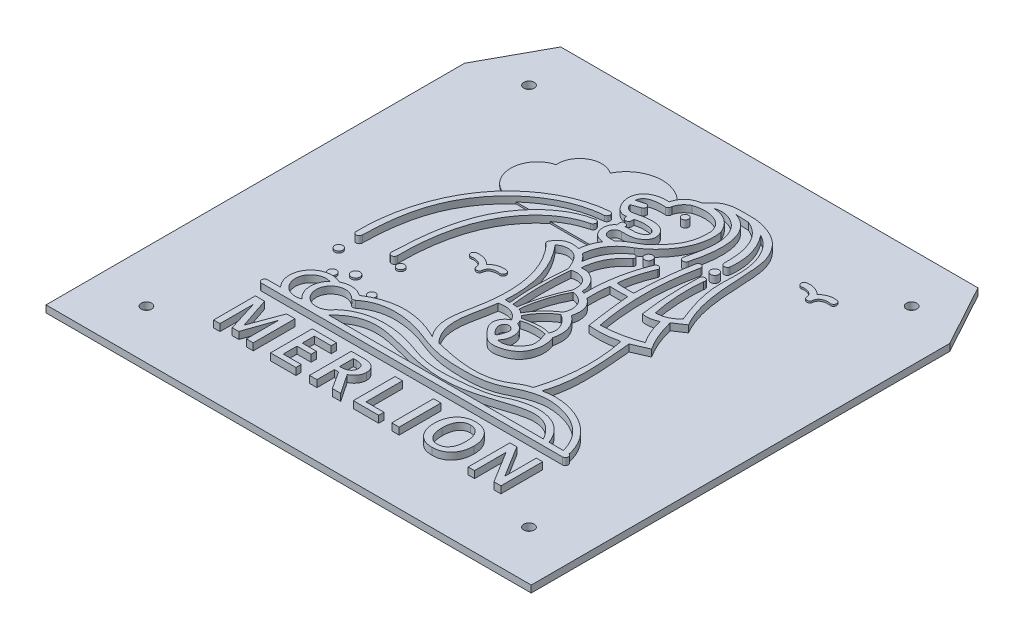
from build123d import *

# Parameters (mm, degrees)
SKETCH2_R           = 1.5
BOSS_EXTRUDE1_DEPTH = 2
SKETCH7_R           = 0.983682585
SKETCH7_R_2         = 1.165243801
SKETCH7_R_3         = 1.175134234
BOSS_EXTRUDE7_DEPTH = 2
SKETCH8_R           = 1.105287723
SKETCH8_R_2         = 1.166518973
SKETCH8_R_3         = 1.187770486
SKETCH8_R_4         = 1.27175729
SKETCH8_R_5         = 1.10281721
BOSS_EXTRUDE8_DEPTH = 0.5
SKETCH9_W           = 2.126582278
SKETCH9_H           = 12
BOSS_EXTRUDE9_DEPTH = 2


with BuildPart() as part:
    # Sketch2 → Boss-Extrude1 (new body)
    with BuildSketch(Plane(origin=(0, 0, 0), x_dir=(1, 0, 0), z_dir=(0, 1, 0))):
        Polygon((-69.75, 120.33), (-69.75, 0), (69.75, 0), (69.75, 120.33), (59.98, 138.212299614), (-59.98, 138.212299614), align=None)
        with Locations(Location((-55, 124.11, 0), (0, 0, 270))):
            Circle(SKETCH2_R, mode=Mode.SUBTRACT)
        with Locations(Location((55, 124.11, 0), (0, 0, 270))):
            Circle(SKETCH2_R, mode=Mode.SUBTRACT)
        with Locations(Location((55, 14.11, 0), (0, 0, 270))):
            Circle(SKETCH2_R, mode=Mode.SUBTRACT)
        with Locations(Location((-55, 14.11, 0), (0, 0, 270))):
            Circle(SKETCH2_R, mode=Mode.SUBTRACT)
    extrude(amount=BOSS_EXTRUDE1_DEPTH)

    # Sketch7 → Boss-Extrude7 (add)
    # profile 1 of 6: a face of its own
    with BuildSketch(Plane(origin=(0, 2, 0), x_dir=(1, 0, 0), z_dir=(0, 1, 0))):
        with BuildLine():
            Line((-42.162398014, 34.388319998), (44.30026305, 34.388319998))
            ThreePointArc((44.30026305, 34.388319998), (45.153694791, 35.127607216), (44.543662643, 36.077739893))
            add(Edge.make_bspline(
                [(24.959885227, 47.871950717), (33.075919528, 49.805881135), (42.865888505, 44.829138348), (44.543662643, 36.077739893)],
                knots=[0, 0, 0, 0, 1, 1, 1, 1], degree=3))
            add(Edge.make_bspline(
                [(25.793593052, 72.085830217), (26.401612273, 64.099453677), (27.646212615, 55.626425096), (24.959885227, 47.871950717)],
                knots=[0, 0, 0, 0, 1, 1, 1, 1], degree=3))
            Line((25.793593052, 72.085830217), (30.293259984, 74.04489615))
            add(Edge.make_bspline(
                [(26.427351906, 83.273192851), (27.57464599, 78.336846938), (30.293259984, 74.04489615)],
                knots=[0, 0, 0, 1, 1, 1], degree=2))
            Line((26.427351906, 83.273192851), (29.584812233, 85.372416823))
            add(Edge.make_bspline(
                [(12.20629066, 121.285552405), (13.514175446, 121.386233607), (20.986245082, 119.789312608), (24.752060251, 113.444104137), (25.716103303, 101.276196825), (25.531170346, 92.405200058), (29.584812233, 85.372416823)],
                knots=[0, 0, 0, 0, 0.163326357, 0.384304108, 0.482541318, 1, 1, 1, 1], degree=3))
            add(Edge.make_bspline(
                [(1.298903469, 117.680961578), (3.147554979, 119.895055321), (5.115995128, 121.679939997), (12.169241901, 121.282700385), (12.20629066, 121.285552405)],
                knots=[0, 0, 0, 0, 0.585987981, 1, 1, 1, 1], degree=3))
            add(Edge.make_bspline(
                [(-3.824826696, 113.189399394), (-2.87156857, 117.054110163), (1.298903469, 117.680961578)],
                knots=[0, 0, 0, 1, 1, 1], degree=2))
            add(Edge.make_bspline(
                [(-6.328131594, 103.501265338), (-8.436713605, 102.969408537), (-11.277390259, 106.497426215), (-10.234811729, 112.412863214), (-5.834282199, 113.473917833), (-3.824826696, 113.189399394)],
                knots=[0, 0, 0, 0, 0.37112387, 0.59345777, 1, 1, 1, 1], degree=3))
            add(Edge.make_bspline(
                [(-6.328131594, 103.501265338), (-6.411465012, 103.013045445), (-5.85942482, 102.056992715), (-4.429192897, 102.476045746), (-4.455894197, 103.40813018), (-4.550688829, 103.817236428)],
                knots=[0, 0, 0, 0, 0.417960585, 0.636874349, 1, 1, 1, 1], degree=3))
            add(Edge.make_bspline(
                [(0.337768146, 103.948024021), (-2.074981037, 104.525256057), (-4.550688829, 103.817236428)],
                knots=[0, 0, 0, 1, 1, 1], degree=2))
            add(Edge.make_bspline(
                [(-3.98221129, 100.706478959), (-2.651426799, 100.93321151), (-0.046282353, 100.259935941), (2.334779178, 102.855550127), (0.337768146, 103.948024021)],
                knots=[0, 0, 0, 0, 0.520536172, 1, 1, 1, 1], degree=3))
            add(Edge.make_bspline(
                [(-5.596988676, 100.000585213), (-5.704000852, 100.39236475), (-5.969751303, 102.117121976), (-3.828377069, 101.548847015), (-3.98221129, 100.706478959)],
                knots=[0, 0, 0, 0, 0.434244281, 1, 1, 1, 1], degree=3))
            add(Edge.make_bspline(
                [(-5.596988676, 100.000585213), (-7.285536017, 98.94930618), (-7.29840258, 94.747250023), (-4.316805496, 93.848292072), (-3.443283955, 93.734969088)],
                knots=[0, 0, 0, 0, 0.676200208, 1, 1, 1, 1], degree=3))
            add(Edge.make_bspline(
                [(-3.443283955, 93.734969088), (-4.987270921, 91.374932037), (-5.209955257, 88.580172516)],
                knots=[0, 0, 0, 1, 1, 1], degree=2))
            add(Edge.make_bspline(
                [(-11.391567792, 86.074113381), (-9.536614435, 89.684513901), (-5.209955257, 88.580172516)],
                knots=[0, 0, 0, 1, 1, 1], degree=2))
            add(Edge.make_bspline(
                [(-10.926692616, 84.932413531), (-11.646377785, 85.29355022), (-11.391567792, 86.074113381)],
                knots=[0, 0, 0, 1, 1, 1], degree=2))
            add(Edge.make_bspline(
                [(-4.344610911, 45.625088764), (-8.000193236, 50.301771522), (-3.273070157, 63.794292812), (-4.67081094, 78.351217195), (-10.926692616, 84.932413531)],
                knots=[0, 0, 0, 0, 0.374184148, 1, 1, 1, 1], degree=3))
            add(Edge.make_bspline(
                [(-25.069612206, 45.410192753), (-15.762387468, 51.42039312), (-4.344610911, 45.625088764)],
                knots=[0, 0, 0, 1, 1, 1], degree=2))
            ThreePointArc((-25.069612206, 45.410192753), (-28.109875546, 46.524661549), (-31.278998298, 45.859903805))
            ThreePointArc((-31.278998298, 45.859903805), (-38.991805032, 44.020541385), (-38.410099385, 36.112807174))
            Line((-38.410099385, 36.112807174), (-42.162398014, 36.112807174))
            ThreePointArc((-42.162398014, 36.112807174), (-43.024641602, 35.250563586), (-42.162398014, 34.388319998))
        make_face()
        with BuildLine():
            ThreePointArc((-32.437639508, 36.267596517), (-38.495363763, 40.204292708), (-32.824427606, 44.680237653))
            ThreePointArc((-32.824427606, 44.680237653), (-34.406004399, 40.39230923), (-32.437639508, 36.267596517))
        make_face(mode=Mode.SUBTRACT)
        with BuildLine():
            add(Edge.make_bspline(
                [(-2.99364742, 65.280333629), (-2.341819743, 65.282218708), (-1.690032797, 65.273798633)],
                knots=[0, 0, 0, 1, 1, 1], degree=2))
            add(Edge.make_bspline(
                [(-9.441850758, 86.074113381), (-2.121235625, 77.521555448), (-2.99364742, 65.280333629)],
                knots=[0, 0, 0, 1, 1, 1], degree=2))
            add(Edge.make_bspline(
                [(-9.441850758, 86.074113381), (-8.201619154, 87.377802844), (-3.805124444, 87.445288968), (-2.324123385, 83.60794045), (-1.693987133, 82.091173926)],
                knots=[0, 0, 0, 0, 0.491915912, 1, 1, 1, 1], degree=3))
            add(Edge.make_bspline(
                [(-1.690032797, 65.273798633), (-2.599902508, 73.663888669), (-1.693987133, 82.091173926)],
                knots=[0, 0, 0, 1, 1, 1], degree=2))
        make_face(mode=Mode.SUBTRACT)
        with BuildLine():
            Line((37.12745698, 36.112807174), (-24.576104098, 36.112807174))
            add(Edge.make_bspline(
                [(-24.576104098, 36.112807174), (-22.932548896, 37.952870853), (-17.408148664, 41.527232944), (-7.653909426, 39.309503218), (1.9660964, 36.521267161), (12.770729861, 36.171667701), (24.319195297, 40.339159969), (33.38823093, 42.703892034), (37.12745698, 36.112807174)],
                knots=[0, 0, 0, 0, 0.115498101, 0.281887883, 0.432798393, 0.585217629, 0.767439096, 1, 1, 1, 1], degree=3))
        make_face(mode=Mode.SUBTRACT)
        with BuildLine():
            Line((42.84003011, 36.112807174), (38.752051782, 36.112807174))
            add(Edge.make_bspline(
                [(-24.965880215, 38.417948957), (-20.293859527, 42.789627137), (-11.627404549, 43.001212017), (0.209496722, 38.407909513), (5.07927521, 37.911998188), (21.018436608, 39.315879926), (20.058781702, 41.0510699), (31.060761749, 43.730768909), (36.809536487, 41.529268375), (38.752051782, 36.112807174)],
                knots=[0.016029903, 0.016029903, 0.016029903, 0.016029903, 0.209238548, 0.240528367, 0.334428601, 0.377612165, 0.660626482, 0.719915903, 1, 1, 1, 1], degree=3))
            ThreePointArc((-24.965880215, 38.417948957), (-25.460951482, 37.776912844), (-26.069477871, 37.242386426))
            ThreePointArc((-26.069477871, 37.242386426), (-32.749040301, 40.756974457), (-25.918342545, 43.967963627))
            add(Edge.make_bspline(
                [(-25.918342545, 43.967963627), (-25.249551628, 43.167318113), (-24.407210907, 43.64646613)],
                knots=[0, 0, 0, 1, 1, 1], degree=2))
            add(Edge.make_bspline(
                [(-24.407210907, 43.64646613), (-22.002204629, 45.647221399), (-16.141478994, 47.224332299), (-6.326447184, 45.026996001), (-0.495197842, 41.805311769), (15.714635826, 41.46023091), (19.522353331, 44.558169456), (26.049050069, 46.740687362), (32.757132323, 46.408670076), (40.874529275, 43.871496892), (42.84003011, 36.112807174)],
                knots=[0, 0, 0, 0, 0.133923172, 0.258153912, 0.412618784, 0.501566703, 0.692749055, 0.812953033, 0.843678128, 1, 1, 1, 1], degree=3))
        make_face(mode=Mode.SUBTRACT)
        with BuildLine():
            add(Edge.make_bspline(
                [(4.216759403, 55.231969696), (3.930302314, 55.248113273), (2.932660375, 56.540314833), (2.155088641, 58.141791225), (3.60317372, 59.788544578), (5.632050904, 58.823796799), (5.205398787, 57.010639726), (4.639847541, 55.20812614), (4.216759403, 55.231969696)],
                knots=[0, 0, 0, 0, 0.123714777, 0.355044532, 0.478595894, 0.643227531, 0.817277154, 1, 1, 1, 1], degree=3))
        make_face(mode=Mode.SUBTRACT)
        with BuildLine():
            add(Edge.make_bspline(
                [(4.316290321, 62.206486597), (4.610674734, 61.669634289), (4.737190605, 61.070055829)],
                knots=[0, 0, 0, 1, 1, 1], degree=2))
            add(Edge.make_bspline(
                [(4.316290321, 62.206486597), (7.74713308, 63.240684578), (11.265897221, 62.487641891)],
                knots=[0, 0, 0, 1, 1, 1], degree=2))
            add(Edge.make_bspline(
                [(11.265897221, 62.487641891), (11.723455926, 61.135564951), (12.769346469, 58.419961359), (10.044914681, 55.032523923), (7.713519752, 53.653365077), (5.874492548, 54.237220294)],
                knots=[0, 0, 0, 0, 0.376184761, 0.582397255, 1, 1, 1, 1], degree=3))
            add(Edge.make_bspline(
                [(4.737190605, 61.070055829), (7.51957792, 60.400311928), (7.902476182, 56.00307899), (5.874492548, 54.237220294)],
                knots=[0, 0, 0, 0, 1, 1, 1, 1], degree=3))
        make_face(mode=Mode.SUBTRACT)
        with BuildLine():
            add(Edge.make_bspline(
                [(-3.185878755, 63.428244487), (-3.928351227, 57.207435013), (-7.153264996, 50.84399357), (-1.819162403, 44.997632949)],
                knots=[0, 0, 0, 0, 1, 1, 1, 1], degree=3))
            add(Edge.make_bspline(
                [(-3.185878755, 63.428244487), (1.020950974, 64.35731677), (2.932818134, 61.153755067)],
                knots=[0, 0, 0, 1, 1, 1], degree=2))
            add(Edge.make_bspline(
                [(2.932818134, 61.153755067), (1.618314982, 60.671952791), (-0.579693599, 57.293803388), (2.491103229, 54.535680372), (3.573519379, 53.529410251)],
                knots=[0, 0, 0, 0, 0.449877277, 1, 1, 1, 1], degree=3))
            add(Edge.make_bspline(
                [(13.25345056, 62.673220673), (14.385493567, 60.145959922), (13.709731425, 54.896380593), (8.147906361, 52.139687161), (4.824729789, 52.07343414), (3.573519379, 53.529410251)],
                knots=[0, 0, 0, 0, 0.480478364, 0.711460949, 1, 1, 1, 1], degree=3))
            add(Edge.make_bspline(
                [(10.409397985, 70.916871114), (14.478169864, 67.746465678), (13.25345056, 62.673220673)],
                knots=[0, 0, 0, 1, 1, 1], degree=2))
            add(Edge.make_bspline(
                [(8.382296163, 77.385822954), (11.631000223, 75.066089221), (10.409397985, 70.916871114)],
                knots=[0, 0, 0, 1, 1, 1], degree=2))
            add(Edge.make_bspline(
                [(8.675452131, 83.654704119), (8.266015135, 80.531283184), (8.382296163, 77.385822954)],
                knots=[0, 0, 0, 1, 1, 1], degree=2))
            add(Edge.make_bspline(
                [(13.810599468, 83.688049231), (11.243572792, 83.572746381), (8.675452131, 83.654704119)],
                knots=[0, 0, 0, 1, 1, 1], degree=2))
            add(Edge.make_bspline(
                [(13.810599468, 83.688049231), (14.372409535, 77.273232447), (15.411164872, 70.916871114)],
                knots=[0, 0, 0, 1, 1, 1], degree=2))
            add(Edge.make_bspline(
                [(23.997311232, 71.512098154), (19.748956647, 70.557768956), (15.411164872, 70.916871114)],
                knots=[0, 0, 0, 1, 1, 1], degree=2))
            add(Edge.make_bspline(
                [(23.997311232, 71.512098154), (26.584263621, 59.297221304), (22.820422935, 47.438497151)],
                knots=[0, 0, 0, 1, 1, 1], degree=2))
            add(Edge.make_bspline(
                [(-1.819162403, 44.997632949), (4.16453274, 43.534421393), (14.199514821, 41.394350406), (20.890603581, 47.11165088), (22.820422935, 47.438497151)],
                knots=[0, 0, 0, 0, 0.776426315, 1, 1, 1, 1], degree=3))
        make_face(mode=Mode.SUBTRACT)
        with BuildLine():
            add(Edge.make_bspline(
                [(3.286140845, 63.716859621), (3.641238856, 63.414085691), (3.862853135, 63.001275557)],
                knots=[0, 0, 0, 1, 1, 1], degree=2))
            add(Edge.make_bspline(
                [(3.286140845, 63.716859621), (5.126846822, 67.416608992), (8.675452131, 69.620156736)],
                knots=[0, 0, 0, 1, 1, 1], degree=2))
            add(Edge.make_bspline(
                [(8.675452131, 69.620156736), (10.738906075, 68.385331677), (12.735126119, 65.787439217), (11.532785422, 63.274535873)],
                knots=[0, 0, 0, 0, 1, 1, 1, 1], degree=3))
            add(Edge.make_bspline(
                [(3.862853135, 63.001275557), (6.375260281, 63.444683605), (9.020263964, 64.212364759), (11.532785422, 63.274535873)],
                knots=[0, 0, 0, 0, 1, 1, 1, 1], degree=3))
        make_face(mode=Mode.SUBTRACT)
        with BuildLine():
            add(Edge.make_bspline(
                [(4.854045769, 76.879736108), (1.860567248, 71.310277727), (1.298903469, 64.923887628)],
                knots=[0, 0, 0, 1, 1, 1], degree=2))
            add(Edge.make_bspline(
                [(4.854045769, 76.879736108), (5.01659948, 77.077073552), (9.126307329, 75.990309859), (9.040791393, 71.860383141), (8.382296163, 70.521824636)],
                knots=[0, 0, 0, 0, 0.519772893, 1, 1, 1, 1], degree=3))
            add(Edge.make_bspline(
                [(2.461606006, 64.24641123), (4.637958876, 68.132846812), (8.382296163, 70.521824636)],
                knots=[0, 0, 0, 1, 1, 1], degree=2))
            add(Edge.make_bspline(
                [(1.298903469, 64.923887628), (1.956553234, 64.712097274), (2.461606006, 64.24641123)],
                knots=[0, 0, 0, 1, 1, 1], degree=2))
        make_face(mode=Mode.SUBTRACT)
        with BuildLine():
            add(Edge.make_bspline(
                [(-0.887144159, 82.091173926), (-1.744285873, 73.686737026), (-0.785902603, 65.273798633)],
                knots=[0, 0, 0, 1, 1, 1], degree=2))
            add(Edge.make_bspline(
                [(-0.887144159, 82.091173926), (0.577646191, 82.701476153), (4.158253254, 81.789191176), (4.352789712, 78.508810249), (4.216759403, 77.385822954)],
                knots=[0, 0, 0, 0, 0.574294921, 1, 1, 1, 1], degree=3))
            add(Edge.make_bspline(
                [(4.216759403, 77.385822954), (1.432894878, 71.547943278), (0.453321238, 65.175096926)],
                knots=[0, 0, 0, 1, 1, 1], degree=2))
            add(Edge.make_bspline(
                [(0.453321238, 65.175096926), (-0.158440088, 65.323081885), (-0.785902603, 65.273798633)],
                knots=[0, 0, 0, 1, 1, 1], degree=2))
        make_face(mode=Mode.SUBTRACT)
        with BuildLine():
            Line((-1.816188446, 95.617976441), (-3.608294208, 95.617976441))
            add(Edge.make_bspline(
                [(-3.29554539, 98.945968516), (-4.153723976, 99.044704363), (-6.042646145, 97.515934477), (-4.601734475, 95.587033342), (-3.608294208, 95.617976441)],
                knots=[0, 0, 0, 0, 0.499483183, 1, 1, 1, 1], degree=3))
            add(Edge.make_bspline(
                [(-6.560268883, 105.236999734), (-4.386538012, 105.805066352), (-0.660870051, 106.598119199), (2.752998749, 104.8536146), (3.369062894, 101.621466851), (0.793464045, 99.035890235), (-0.89977919, 98.969035911), (-3.29554539, 98.945968516)],
                knots=[0, 0, 0, 0, 0.331805277, 0.515953476, 0.641551083, 0.744836033, 1, 1, 1, 1], degree=3))
            add(Edge.make_bspline(
                [(-8.768556128, 106.892339826), (-8.289685935, 105.292646885), (-6.560268883, 105.236999734)],
                knots=[0, 0, 0, 1, 1, 1], degree=2))
            Line((-8.768556128, 106.892339826), (-6.328131594, 107.775932589))
            ThreePointArc((-6.328131594, 107.775932589), (-5.744336373, 108.824002389), (-6.792406172, 109.407797609))
            Line((-6.792406172, 109.407797609), (-9.04675963, 108.766421644))
            add(Edge.make_bspline(
                [(-9.04675963, 108.766421644), (-8.907564805, 111.492993553), (-5.038884545, 111.517723207), (-3.128001886, 111.437206683)],
                knots=[0, 0, 0, 0, 1, 1, 1, 1], degree=3))
            ThreePointArc((-3.128001886, 111.437206683), (-2.448453757, 111.718139113), (-2.253148136, 112.427056883))
            add(Edge.make_bspline(
                [(-2.253148136, 112.427056883), (-1.698644546, 114.523507676), (0.337768146, 115.63684654)],
                knots=[0, 0, 0, 1, 1, 1], degree=2))
            add(Edge.make_bspline(
                [(0.337768146, 115.63684654), (3.729464256, 116.804576846), (8.898397935, 116.248417477), (9.612860776, 111.718139113)],
                knots=[0, 0, 0, 0, 1, 1, 1, 1], degree=3))
            add(Edge.make_bspline(
                [(9.612860776, 111.718139113), (9.960033331, 105.165836261), (4.854045769, 100.799181054)],
                knots=[0, 0, 0, 1, 1, 1], degree=2))
            add(Edge.make_bspline(
                [(-1.816188446, 95.617976441), (-0.013543728, 97.937945838), (3.256048341, 98.271202004), (4.854045769, 100.799181054)],
                knots=[0, 0, 0, 0, 1, 1, 1, 1], degree=3))
        make_face(mode=Mode.SUBTRACT)
        with BuildLine():
            add(Edge.make_bspline(
                [(13.773856382, 101.11801446), (15.464561531, 107.101291322), (16.874504073, 117.120286387), (8.864393268, 119.685325947)],
                knots=[0, 0, 0, 0, 1, 1, 1, 1], degree=3))
            Line((8.864393268, 119.685325947), (12.696564392, 119.516591652))
            add(Edge.make_bspline(
                [(12.696564392, 119.516591652), (18.835877475, 117.071188081), (19.434271912, 110.134855581), (19.313605636, 105.970979592)],
                knots=[0, 0, 0, 0, 0.995674633, 0.995674633, 0.995674633, 0.995674633], degree=3))
            add(Edge.make_bspline(
                [(19.313605636, 105.970979592), (19.313081443, 105.952891061), (19.31254368, 105.934854851), (19.311992742, 105.916871557)],
                knots=[0.995674633, 0.995674633, 0.995674633, 0.995674633, 1, 1, 1, 1], degree=3))
            ThreePointArc((19.311992742, 105.916871557), (20.146238402, 105.011510496), (21.11667285, 105.769073335))
            add(Edge.make_bspline(
                [(21.127387374, 105.866642905), (21.122155128, 105.817894904), (21.11667285, 105.769073335)],
                knots=[0.992873951, 0.992873951, 0.992873951, 1, 1, 1], degree=2))
            add(Edge.make_bspline(
                [(17.731555689, 118.0225988), (21.856397341, 112.658712816), (21.127387374, 105.866642905)],
                knots=[0, 0, 0, 0.992873951, 0.992873951, 0.992873951], degree=2))
            add(Edge.make_bspline(
                [(17.731555689, 118.0225988), (21.878922602, 115.839479247), (24.784412538, 108.517682324), (23.26581795, 97.03125948), (25.797245192, 90.047606525), (27.348470901, 86.074113381)],
                knots=[0, 0, 0, 0, 0.382795077, 0.621776428, 1, 1, 1, 1], degree=3))
            add(Edge.make_bspline(
                [(21.837335692, 83.621359006), (25.089790439, 83.64050844), (27.348470901, 86.074113381)],
                knots=[0, 0, 0, 1, 1, 1], degree=2))
            add(Edge.make_bspline(
                [(20.99731171, 98.283925149), (20.287401782, 90.902354495), (21.837335692, 83.621359006)],
                knots=[0, 0, 0, 1, 1, 1], degree=2))
            ThreePointArc((20.99731171, 98.283925149), (20.457993214, 99.470311503), (19.369696583, 98.753382312))
            add(Edge.make_bspline(
                [(19.369696583, 98.753382312), (19.366579393, 98.684533996), (19.363565363, 98.615690481)],
                knots=[0, 0, 0, 0.007941444, 0.007941444, 0.007941444], degree=2))
            add(Edge.make_bspline(
                [(19.363565363, 98.615690481), (18.987047617, 90.015642922), (20.220384925, 81.490533347)],
                knots=[0.007941444, 0.007941444, 0.007941444, 1, 1, 1], degree=2))
            add(Edge.make_bspline(
                [(24.692384926, 82.178110274), (22.597238307, 81.042311525), (20.220384925, 81.490533347)],
                knots=[0, 0, 0, 1, 1, 1], degree=2))
            add(Edge.make_bspline(
                [(24.692384926, 82.178110274), (25.505169752, 78.15785854), (27.79912574, 74.747682287)],
                knots=[0, 0, 0, 1, 1, 1], degree=2))
            add(Edge.make_bspline(
                [(16.958346966, 72.604022139), (22.543698002, 72.798944419), (27.79912574, 74.747682287)],
                knots=[0, 0, 0, 1, 1, 1], degree=2))
            add(Edge.make_bspline(
                [(17.134639817, 101.18627489), (14.10024807, 87.080300841), (16.958346966, 72.604022139)],
                knots=[0.000695352, 0.000695352, 0.000695352, 1, 1, 1], degree=2))
            ThreePointArc((17.134639817, 101.18627489), (17.136809747, 101.196077965), (17.13886555, 101.205905608))
            ThreePointArc((17.13886555, 101.205905608), (16.441068742, 102.2284646), (15.438182155, 101.502678286))
            add(Edge.make_bspline(
                [(13.810599468, 85.372416823), (13.906902275, 93.514138789), (15.438182155, 101.502678286)],
                knots=[0, 0, 0, 1, 1, 1], degree=2))
            add(Edge.make_bspline(
                [(8.908602422, 85.529770615), (11.35462476, 85.29490975), (13.810599468, 85.372416823)],
                knots=[0, 0, 0, 1, 1, 1], degree=2))
            add(Edge.make_bspline(
                [(11.235523108, 94.452752351), (9.411121186, 90.164261081), (8.908602422, 85.529770615)],
                knots=[0.036456493, 0.036456493, 0.036456493, 1, 1, 1], degree=2))
            add(Edge.make_bspline(
                [(11.375471069, 94.776774509), (11.304550916, 94.615011088), (11.235523108, 94.452752351)],
                knots=[0, 0, 0, 0.036456493, 0.036456493, 0.036456493], degree=2))
            ThreePointArc((11.375471069, 94.776774509), (10.807990883, 95.740018068), (9.786421187, 95.285851499))
            add(Edge.make_bspline(
                [(9.761180623, 95.223376953), (9.773775337, 95.254618883), (9.786421187, 95.285851499)],
                knots=[0.996196383, 0.996196383, 0.996196383, 1, 1, 1], degree=2))
            add(Edge.make_bspline(
                [(6.671585289, 78.219450768), (6.46252853, 87.04087615), (9.761180623, 95.223376953)],
                knots=[0, 0, 0, 0.996196383, 0.996196383, 0.996196383], degree=2))
            Line((6.671585289, 78.219450768), (5.874492548, 78.509144173))
            add(Edge.make_bspline(
                [(-0.046477963, 84.128664952), (3.003506738, 84.832711416), (6.244829432, 81.53191896), (5.874492548, 78.509144173)],
                knots=[0, 0, 0, 0, 1, 1, 1, 1], degree=3))
            add(Edge.make_bspline(
                [(5.087485234, 93.854044605), (0.402370416, 90.200064373), (-0.046477963, 84.128664952)],
                knots=[0, 0, 0, 1, 1, 1], degree=2))
            ThreePointArc((5.087485234, 93.854044605), (4.970412385, 94.955503951), (3.862853135, 94.940296994))
            add(Edge.make_bspline(
                [(-1.538001507, 85.789881753), (-0.765273431, 91.604519007), (3.862853135, 94.940296994)],
                knots=[0, 0, 0, 1, 1, 1], degree=2))
            add(Edge.make_bspline(
                [(-3.443283955, 87.898321425), (-2.269861916, 87.049692887), (-1.538001507, 85.789881753)],
                knots=[0, 0, 0, 1, 1, 1], degree=2))
            add(Edge.make_bspline(
                [(-3.443283955, 87.898321425), (-2.800229998, 93.910618306), (2.645291574, 96.759964681)],
                knots=[0, 0, 0, 1, 1, 1], degree=2))
            add(Edge.make_bspline(
                [(2.645291574, 96.759964681), (7.967021276, 100.068214723), (12.386170067, 106.722829559), (11.116624897, 113.189399394)],
                knots=[0, 0, 0, 0, 1, 1, 1, 1], degree=3))
            add(Edge.make_bspline(
                [(11.116624897, 113.189399394), (9.116808288, 117.84998046), (4.216759403, 118.0225988)],
                knots=[0, 0, 0, 1, 1, 1], degree=2))
            add(Edge.make_bspline(
                [(4.216759403, 118.0225988), (6.583596945, 118.90672281), (10.555529963, 117.610077459), (14.398593767, 110.917201945), (12.819033683, 105.294553797), (12.05470344, 101.618049561)],
                knots=[0, 0, 0, 0, 0.329991094, 0.465742628, 1, 1, 1, 1], degree=3))
            ThreePointArc((12.05470344, 101.618049561), (12.649556992, 100.457897535), (13.773856382, 101.11801446))
        make_face(mode=Mode.SUBTRACT)
    # profile 2 of 6: a face of its own
    with BuildSketch(Plane(origin=(0, 2, 0), x_dir=(1, 0, 0), z_dir=(0, 1, 0))):
        with BuildLine():
            add(Edge.make_bspline(
                [(-39.68615558, 60.86479462), (-39.597189309, 67.383708286), (-37.46080011, 85.81078113), (-21.685016151, 99.525573785), (-9.957433166, 100.545446195)],
                knots=[0, 0, 0, 0, 0.362724151, 0.997300882, 0.997300882, 0.997300882, 0.997300882], degree=3))
            add(Edge.make_bspline(
                [(-9.957433166, 100.545446195), (-9.907550896, 100.549784135), (-9.85763806, 100.553982647), (-9.807694952, 100.558041286)],
                knots=[0.997300882, 0.997300882, 0.997300882, 0.997300882, 1, 1, 1, 1], degree=3))
            ThreePointArc((-9.807694952, 100.558041286), (-9.0494806, 101.533711002), (-9.95878489, 102.370362726))
            add(Edge.make_bspline(
                [(-9.95878489, 102.370362726), (-10.014957107, 102.365300749), (-10.071098125, 102.360074401), (-10.127207476, 102.354684218)],
                knots=[0, 0, 0, 0, 0.0029198, 0.0029198, 0.0029198, 0.0029198], degree=3))
            add(Edge.make_bspline(
                [(-10.127207476, 102.354684218), (-18.749116082, 101.526414693), (-36.248110484, 91.088593209), (-41.65050298, 71.123865966), (-41.447624347, 60.86479462)],
                knots=[0.0029198, 0.0029198, 0.0029198, 0.0029198, 0.45158388, 1, 1, 1, 1], degree=3))
            ThreePointArc((-41.447624347, 60.86479462), (-40.566889964, 59.984060237), (-39.68615558, 60.86479462))
        make_face()
    # profile 3 of 6: a face of its own
    with BuildSketch(Plane(origin=(0, 2, 0), x_dir=(1, 0, 0), z_dir=(0, 1, 0))):
        with BuildLine():
            add(Edge.make_bspline(
                [(-9.807694952, 96.527682177), (-16.23068529, 94.949226239), (-27.515577639, 84.09321871), (-29.56648911, 68.823472009), (-29.492315407, 60.792069089)],
                knots=[0, 0, 0, 0, 0.442157766, 0.999623969, 0.999623969, 0.999623969, 0.999623969], degree=3))
            ThreePointArc((-9.807694952, 96.527682177), (-9.065272249, 97.609853159), (-10.191288437, 98.283925149))
            add(Edge.make_bspline(
                [(-31.229901059, 60.845362758), (-30.895289892, 69.179071239), (-29.536749892, 85.177621527), (-17.007484287, 96.940921453), (-10.191288437, 98.283925149)],
                knots=[0.001531236, 0.001531236, 0.001531236, 0.001531236, 0.551911238, 1, 1, 1, 1], degree=3))
            add(Edge.make_bspline(
                [(-31.232684313, 60.775817352), (-31.231759725, 60.798995374), (-31.230831996, 60.822177189), (-31.229901059, 60.845362758)],
                knots=[0, 0, 0, 0, 0.001531236, 0.001531236, 0.001531236, 0.001531236], degree=3))
            ThreePointArc((-31.232684313, 60.775817352), (-30.36242398, 59.905557019), (-29.492163647, 60.775817352))
            ThreePointArc((-29.492163647, 60.775817352), (-29.492201588, 60.783943575), (-29.492315407, 60.792069089))
        make_face()
    # profile 4 of 6: a face of its own
    with BuildSketch(Plane(origin=(0, 2, 0), x_dir=(1, 0, 0), z_dir=(0, 1, 0))):
        with Locations(Location((2.30133881, 111.718139113, 0), (0, 0, 270))):
            Circle(SKETCH7_R)
    # profile 5 of 6: a face of its own
    with BuildSketch(Plane(origin=(0, 2, 0), x_dir=(1, 0, 0), z_dir=(0, 1, 0))):
        with Locations(Location((7.064971547, 96.41382971, 0), (0, 0, 270))):
            Circle(SKETCH7_R_2)
    # profile 6 of 6: a face of its own
    with BuildSketch(Plane(origin=(0, 2, 0), x_dir=(1, 0, 0), z_dir=(0, 1, 0))):
        with Locations(Location((20.220384925, 102.284895507, 0), (0, 0, 270))):
            Circle(SKETCH7_R_3)
    extrude(amount=BOSS_EXTRUDE7_DEPTH)

    # Sketch8 → Boss-Extrude8 (add)
    with BuildSketch(Plane(origin=(0, 2, 0), x_dir=(1, 0, 0), z_dir=(0, 1, 0))):
        with BuildLine():
            Line((-17.527945097, 92.690673572), (-4.050934577, 92.690673572))
            Line((-4.050934577, 92.690673572), (-2.003658948, 94.737949201))
            Line((-2.003658948, 94.737949201), (-5.81354399, 95.256346384))
            Line((-5.81354399, 95.256346384), (-5.81354399, 98.278040157))
            Line((-5.81354399, 98.278040157), (-3.908601469, 99.788887043))
            Line((-3.908601469, 99.788887043), (1.309019903, 100.339301599))
            Line((1.309019903, 100.339301599), (2.118402163, 102.702663181))
            Line((2.118402163, 102.702663181), (1.110503745, 104.760479174))
            Line((1.110503745, 104.760479174), (-5.381873451, 104.760479174))
            Line((-5.381873451, 104.760479174), (-8.457526041, 104.760479174))
            Line((-8.457526041, 104.760479174), (-9.760050071, 107.419829293))
            Line((-9.760050071, 107.419829293), (-9.760050071, 110.418774065))
            Line((-9.760050071, 110.418774065), (-3.027296762, 112.631085577))
            Line((-3.027296762, 112.631085577), (-3.225685251, 114.778216899))
            ThreePointArc((-3.225685251, 114.778216899), (-11.941914154, 119.119122512), (-20.423675847, 114.3362545))
            ThreePointArc((-20.423675847, 114.3362545), (-20.694541385, 113.888868637), (-20.942548444, 113.428418044))
            ThreePointArc((-20.942548444, 113.428418044), (-21.026247729, 113.484516126), (-21.110828519, 113.539276104))
            ThreePointArc((-21.110828519, 113.539276104), (-27.758203169, 113.634587039), (-30.831561037, 107.739576832))
            ThreePointArc((-30.831561037, 107.739576832), (-36.38193063, 99.054445116), (-28.273877393, 92.690673572))
            Line((-28.273877393, 92.690673572), (-17.527945097, 92.690673572))
        make_face()
        with BuildLine():
            add(Edge.make_bspline(
                [(-11.595547292, 74.335852188), (-14.052291044, 74.73606371), (-16.01084801, 72.970317548)],
                knots=[0, 0, 0, 1, 1, 1], degree=2))
            Line((-16.01084801, 72.970317548), (-16.01084801, 70.021677045))
            ThreePointArc((-16.01084801, 70.021677045), (-15.387838938, 70.279735852), (-15.129780131, 70.902744925))
            add(Edge.make_bspline(
                [(-12.004922294, 72.598904903), (-12.283587695, 72.664582572), (-13.663022264, 72.691187038), (-14.965452151, 72.080082827), (-15.129780131, 70.902744925)],
                knots=[0, 0, 0, 0, 0.236952179, 1, 1, 1, 1], degree=3))
            ThreePointArc((-12.004922294, 72.598904903), (-10.931761151, 73.262691045), (-11.595547292, 74.335852188))
        make_face()
        with BuildLine():
            Line((-16.01084801, 70.021677045), (-16.01084801, 72.970317548))
            add(Edge.make_bspline(
                [(-20.426148727, 74.335852188), (-17.969404975, 74.73606371), (-16.01084801, 72.970317548)],
                knots=[0, 0, 0, 1, 1, 1], degree=2))
            ThreePointArc((-20.426148727, 74.335852188), (-21.089934868, 73.262691045), (-20.016773725, 72.598904903))
            add(Edge.make_bspline(
                [(-20.016773725, 72.598904903), (-19.738108325, 72.664582572), (-18.358673755, 72.691187038), (-17.056243868, 72.080082827), (-16.891915889, 70.902744925)],
                knots=[0, 0, 0, 0, 0.236952179, 1, 1, 1, 1], degree=3))
            ThreePointArc((-16.891915889, 70.902744925), (-16.633857082, 70.279735852), (-16.01084801, 70.021677045))
        make_face()
        with BuildLine():
            add(Edge.make_bspline(
                [(34.573851273, 114.335852188), (37.030595025, 114.73606371), (38.98915199, 112.970317548)],
                knots=[0, 0, 0, 1, 1, 1], degree=2))
            ThreePointArc((34.573851273, 114.335852188), (33.910065132, 113.262691045), (34.983226275, 112.598904903))
            add(Edge.make_bspline(
                [(34.983226275, 112.598904903), (35.261891675, 112.664582572), (36.641326245, 112.691187038), (37.943756132, 112.080082827), (38.108084111, 110.902744925)],
                knots=[0, 0, 0, 0, 0.236952179, 1, 1, 1, 1], degree=3))
            ThreePointArc((38.108084111, 110.902744925), (38.98915199, 110.021677045), (39.870219869, 110.902744925))
            add(Edge.make_bspline(
                [(42.995077706, 112.598904903), (42.716412305, 112.664582572), (41.336977736, 112.691187038), (40.034547849, 112.080082827), (39.870219869, 110.902744925)],
                knots=[0, 0, 0, 0, 0.236952179, 1, 1, 1, 1], degree=3))
            ThreePointArc((42.995077706, 112.598904903), (44.068238849, 113.262691045), (43.404452708, 114.335852188))
            add(Edge.make_bspline(
                [(43.404452708, 114.335852188), (40.947708956, 114.73606371), (38.98915199, 112.970317548)],
                knots=[0, 0, 0, 1, 1, 1], degree=2))
        make_face()
        with Locations(Location((-27.791899235, 60.019304767, 0), (0, 0, 270))):
            Circle(SKETCH8_R)
        with Locations(Location((-41.390287587, 55.799115278, 0), (0, 0, 270))):
            Circle(SKETCH8_R_2)
        with Locations(Location((-36.246043732, 48.800124959, 0), (0, 0, 270))):
            Circle(SKETCH8_R_3)
        with Locations(Location((-32.333917228, 51.590592815, 0), (0, 0, 270))):
            Circle(SKETCH8_R_4)
        with Locations(Location((-24.892669612, 48.800124959, 0), (0, 0, 270))):
            Circle(SKETCH8_R_5)
    extrude(amount=BOSS_EXTRUDE8_DEPTH)

    # Sketch9 → Boss-Extrude9 (add)
    # profile 1 of 7: a face of its own
    with BuildSketch(Plane(origin=(0, 2, 0), x_dir=(1, 0, 0), z_dir=(0, 1, 0))):
        Polygon((-39.903399727, 18.338695853), (-39.903399727, 30.338695853), (-37.245171879, 30.338695853), (-34.240425043, 21.426512308), (-30.917640233, 30.338695853), (-28.510994663, 30.338695853), (-28.510994663, 18.338695853), (-30.485678208, 18.338695853), (-30.485678208, 27.5190756), (-33.416849094, 19.098189524), (-35.32745036, 19.098189524), (-38.080614917, 28.026986992), (-38.080614917, 18.338695853), align=None)
    # profile 2 of 7: a face of its own
    with BuildSketch(Plane(origin=(0, 2, 0), x_dir=(1, 0, 0), z_dir=(0, 1, 0))):
        Polygon((-23.528716182, 18.338695853), (-23.528716182, 30.338695853), (-16.574602258, 30.338695853), (-16.574602258, 28.819708511), (-21.402133904, 28.819708511), (-21.402133904, 25.326037625), (-17.360203524, 25.326037625), (-17.360203524, 23.807050283), (-21.402133904, 23.807050283), (-21.402133904, 19.857683194), (-16.237576942, 19.857683194), (-16.237576942, 18.338695853), align=None)
    # profile 3 of 7: a face of its own
    with BuildSketch(Plane(origin=(0, 2, 0), x_dir=(1, 0, 0), z_dir=(0, 1, 0))):
        with BuildLine():
            Line((-12.3185896, 18.338695853), (-12.3185896, 30.338695853))
            Line((-12.3185896, 30.338695853), (-8.64216555, 30.338695853))
            add(Edge.make_bspline(
                [(-8.64216555, 30.338695853), (-8.494938639, 30.336662593), (-8.207876274, 30.332698154), (-7.790548421, 30.294947014), (-7.400821371, 30.230047552), (-7.036105283, 30.146724587), (-6.699695228, 30.032267042), (-6.388036971, 29.894965879), (-6.104375629, 29.730298347), (-5.847316638, 29.542659968), (-5.617542108, 29.333609687), (-5.419798136, 29.10130512), (-5.250787169, 28.851543103), (-5.109711798, 28.58272509), (-5.007709878, 28.291680636), (-4.931624765, 27.983393187), (-4.881822255, 27.655967527), (-4.877679063, 27.430654819), (-4.875551626, 27.314961675)],
                knots=[0, 0, 0, 0, 1.290583137, 2.516373155, 3.669208613, 4.752664155, 5.792341044, 6.779708414, 7.733821168, 8.661939487, 9.565233447, 10.450722791, 11.32988713, 12.204717746, 13.104275762, 14.026152812, 14.986472673, 16, 16, 16, 16], degree=3))
            add(Edge.make_bspline(
                [(-4.875551626, 27.314961675), (-4.877435163, 27.223921725), (-4.881178763, 27.042976494), (-4.909370251, 26.774470933), (-4.960806141, 26.513309653), (-5.025634822, 26.257696249), (-5.115271334, 26.010043004), (-5.221581871, 25.767781469), (-5.347916718, 25.532196107), (-5.492796019, 25.304902808), (-5.652562924, 25.088008322), (-5.827023868, 24.885642864), (-6.012415263, 24.696599828), (-6.212178184, 24.52460209), (-6.421958487, 24.363720114), (-6.645314991, 24.218569801), (-6.882679391, 24.090935695), (-7.047543474, 24.017281268), (-7.130298461, 23.980309777)],
                knots=[0, 0, 0, 0, 1.023519239, 2.034281908, 3.030379068, 4.014168393, 4.996025718, 5.987664977, 6.986498618, 7.998200148, 9.015788814, 10.012402117, 10.999883876, 11.989766323, 12.973555648, 13.970288024, 14.981168098, 16, 16, 16, 16], degree=3))
            Line((-7.130298461, 23.980309777), (-3.356564284, 18.338695853))
            Line((-3.356564284, 18.338695853), (-5.767956689, 18.338695853))
            Line((-5.767956689, 18.338695853), (-8.99580479, 23.351354081))
            Line((-8.99580479, 23.351354081), (-10.192007322, 23.351354081))
            Line((-10.192007322, 23.351354081), (-10.192007322, 18.338695853))
            Line((-10.192007322, 18.338695853), (-12.3185896, 18.338695853))
        make_face()
        with BuildLine():
            Line((-10.192007322, 24.870341422), (-9.961785803, 24.870341422))
            add(Edge.make_bspline(
                [(-9.961785803, 24.870341422), (-9.843070388, 24.872285115), (-9.612463189, 24.87606078), (-9.277863254, 24.901647724), (-8.966073303, 24.946069135), (-8.67704757, 25.009838257), (-8.411179003, 25.092750707), (-8.166572353, 25.192156746), (-7.945428457, 25.310795922), (-7.745934921, 25.447062637), (-7.569664715, 25.60082247), (-7.417859376, 25.774555873), (-7.290650075, 25.965277833), (-7.180925034, 26.17066219), (-7.101773691, 26.39514237), (-7.044970702, 26.635479477), (-7.008353699, 26.892169271), (-7.004244276, 27.069580785), (-7.002133904, 27.160689524)],
                knots=[0, 0, 0, 0, 1.336446071, 2.596074721, 3.775030883, 4.879218195, 5.9243162, 6.906777425, 7.847201582, 8.743973421, 9.621204624, 10.473298707, 11.332946512, 12.197425259, 13.087716357, 14.003655333, 14.974787819, 16, 16, 16, 16], degree=3))
            add(Edge.make_bspline(
                [(-7.002133904, 27.160689524), (-7.003789629, 27.22805887), (-7.007000137, 27.358690302), (-7.036627702, 27.547986044), (-7.082305787, 27.725126938), (-7.15357696, 27.887120025), (-7.237614388, 28.039397051), (-7.347187587, 28.174075783), (-7.470555329, 28.300350971), (-7.617401987, 28.407936061), (-7.780395413, 28.506971375), (-7.963532217, 28.591749211), (-8.166266401, 28.662847764), (-8.388150079, 28.718855686), (-8.628376143, 28.763562288), (-8.88819787, 28.797110306), (-9.167224573, 28.815163041), (-9.359705056, 28.818165526), (-9.458621246, 28.819708511)],
                knots=[0, 0, 0, 0, 0.960655628, 1.862743634, 2.728128611, 3.562700094, 4.381858034, 5.201715811, 6.031923592, 6.894431934, 7.790850831, 8.750444521, 9.768051655, 10.852357116, 12.0125803, 13.253226618, 14.588426451, 16, 16, 16, 16], degree=3))
            Line((-9.458621246, 28.819708511), (-10.192007322, 28.819708511))
            Line((-10.192007322, 28.819708511), (-10.192007322, 24.870341422))
        make_face(mode=Mode.SUBTRACT)
    # profile 4 of 7: a face of its own
    with BuildSketch(Plane(origin=(0, 2, 0), x_dir=(1, 0, 0), z_dir=(0, 1, 0))):
        Polygon((0.25862559, 18.338695853), (0.25862559, 30.338695853), (2.385207868, 30.338695853), (2.385207868, 19.857683194), (7.54976483, 19.857683194), (7.54976483, 18.338695853), align=None)
    # profile 5 of 7: a face of its own
    with BuildSketch(Plane(origin=(0, 2, 0), x_dir=(1, 0, 0), z_dir=(0, 1, 0))):
        with Locations((12.380144577, 24.338695853)):
            Rectangle(SKETCH9_W, SKETCH9_H)
    # profile 6 of 7: a face of its own
    with BuildSketch(Plane(origin=(0, 2, 0), x_dir=(1, 0, 0), z_dir=(0, 1, 0))):
        with BuildLine():
            add(Edge.make_bspline(
                [(23.134574957, 18.034898384), (22.926233065, 18.039482678), (22.518983256, 18.048443682), (21.924166272, 18.13111374), (21.361949038, 18.265908003), (20.831103811, 18.453315274), (20.333464977, 18.69732183), (19.868635693, 18.996355504), (19.433677255, 19.346811053), (19.03630226, 19.750868026), (18.678409352, 20.198705816), (18.366725868, 20.685155056), (18.10134002, 21.206388498), (17.884910869, 21.763708095), (17.720430614, 22.358186941), (17.598850889, 22.98648459), (17.527350326, 23.651118853), (17.518732416, 24.105926495), (17.514321792, 24.338695853)],
                knots=[0, 0, 0, 0, 1.04988093, 2.052221971, 3.02056282, 3.960392271, 4.884372062, 5.80819689, 6.741299476, 7.694565407, 8.659425506, 9.626385429, 10.602090815, 11.603479166, 12.635102297, 13.707522298, 14.826715928, 16, 16, 16, 16], degree=3))
            add(Edge.make_bspline(
                [(17.514321792, 24.338695853), (17.51875078, 24.571461341), (17.527404572, 25.026261422), (17.598566174, 25.690176134), (17.720813181, 26.317533694), (17.884736549, 26.911392592), (18.102104753, 27.469015372), (18.365284216, 27.991497143), (18.679331338, 28.476491896), (19.036022549, 28.924432635), (19.43463272, 29.3277879), (19.867007858, 29.68175083), (20.335434769, 29.977316687), (20.832168784, 30.224294224), (21.363718018, 30.410913623), (21.924851461, 30.54665494), (22.519004216, 30.628875406), (22.926240158, 30.637884451), (23.134574957, 30.642493321)],
                knots=[0, 0, 0, 0, 1.173422404, 2.292747988, 3.361378182, 4.393122943, 5.394629358, 6.374006117, 7.337725989, 8.302699846, 9.256078168, 10.191802304, 11.113589481, 12.043017773, 12.982958032, 13.947536069, 14.949995288, 16, 16, 16, 16], degree=3))
            add(Edge.make_bspline(
                [(23.134574957, 30.642493321), (23.350861934, 30.638188745), (23.774041479, 30.629766561), (24.390415295, 30.543214203), (24.974389892, 30.410569727), (25.521943656, 30.21640754), (26.037243813, 29.972321192), (26.513516244, 29.667803957), (26.957256595, 29.311631462), (27.360153642, 28.900508754), (27.725381943, 28.448960388), (28.042720339, 27.959714982), (28.309262417, 27.436604192), (28.527868631, 26.880899299), (28.69956258, 26.29236084), (28.818466916, 25.670082908), (28.894595498, 25.015431379), (28.902624281, 24.567553805), (28.906726856, 24.338695853)],
                knots=[0, 0, 0, 0, 1.076622274, 2.106481542, 3.093843531, 4.054713365, 4.994117713, 5.927677438, 6.863703814, 7.822219533, 8.789017835, 9.751929696, 10.72119817, 11.70830851, 12.722113646, 13.770027837, 14.860521505, 16, 16, 16, 16], degree=3))
            add(Edge.make_bspline(
                [(28.906726856, 24.338695853), (28.9025651, 24.109847542), (28.894406196, 23.661202411), (28.818905592, 23.00563978), (28.698809751, 22.383090789), (28.530770481, 21.79377318), (28.31193826, 21.237825488), (28.042465207, 20.715785548), (27.725140771, 20.226979738), (27.363646543, 19.773507423), (26.957671863, 19.366415013), (26.517348063, 19.005589356), (26.037128172, 18.70706824), (25.524039115, 18.460045762), (24.976652996, 18.267016994), (24.392820021, 18.134122375), (23.775621376, 18.047530153), (23.351652215, 18.039175874), (23.134574957, 18.034898384)],
                knots=[0, 0, 0, 0, 1.139233166, 2.233406972, 3.281095549, 4.293586971, 5.280484787, 6.251344728, 7.214049276, 8.17817151, 9.13368299, 10.071984022, 11.006572474, 11.942223167, 12.902886126, 13.890035538, 14.919673078, 16, 16, 16, 16], degree=3))
        make_face()
        with BuildLine():
            add(Edge.make_bspline(
                [(23.134574957, 19.553885726), (23.267716107, 19.557183644), (23.52826956, 19.563637575), (23.908242323, 19.624453547), (24.265880304, 19.72385508), (24.600855854, 19.862154298), (24.912964553, 20.039510918), (25.202100618, 20.257657918), (25.468466931, 20.515537534), (25.711044941, 20.811138698), (25.926597586, 21.142995679), (26.117118362, 21.506407877), (26.275563573, 21.903719281), (26.406740405, 22.332214866), (26.503740419, 22.794123531), (26.578237245, 23.28603541), (26.620450615, 23.810264893), (26.62559711, 24.170109504), (26.628245843, 24.355309777)],
                knots=[0, 0, 0, 0, 0.95352057, 1.866012696, 2.749113222, 3.608231015, 4.456278502, 5.314610294, 6.196691157, 7.106961516, 8.048849422, 9.027669002, 10.04253589, 11.109583688, 12.234906327, 13.421537003, 14.672949282, 16, 16, 16, 16], degree=3))
            add(Edge.make_bspline(
                [(26.628245843, 24.355309777), (26.625622103, 24.538933716), (26.620525391, 24.895630137), (26.577997239, 25.415054186), (26.504607623, 25.902651107), (26.403662502, 26.35912978), (26.273157362, 26.784017351), (26.11408107, 27.177384707), (25.926866262, 27.541072289), (25.708120671, 27.870082202), (25.467084691, 28.166776203), (25.198833452, 28.421974796), (24.910721247, 28.640414689), (24.598406607, 28.81742211), (24.264585777, 28.956145058), (23.907116338, 29.052520802), (23.528312736, 29.113907119), (23.267730709, 29.1202598), (23.134574957, 29.123505979)],
                knots=[0, 0, 0, 0, 1.321931509, 2.567901765, 3.748872939, 4.869611187, 5.930810184, 6.945191616, 7.920951225, 8.870420642, 9.784991243, 10.667294854, 11.529681522, 12.381735301, 13.244911683, 14.125172007, 15.041974869, 16, 16, 16, 16], degree=3))
            add(Edge.make_bspline(
                [(23.134574957, 29.123505979), (23.010935558, 29.119994401), (22.768620919, 29.113112235), (22.413859033, 29.054889798), (22.078246422, 28.957926432), (21.761806644, 28.821257687), (21.465299714, 28.646563141), (21.188359392, 28.433335102), (20.930209417, 28.181808221), (20.693533574, 27.89167681), (20.480576737, 27.566331575), (20.293283907, 27.207743159), (20.141275407, 26.813402542), (20.012151496, 26.386860519), (19.914116215, 25.926231065), (19.843398774, 25.432272289), (19.800409014, 24.905124721), (19.795386909, 24.542101825), (19.792802805, 24.355309777)],
                knots=[0, 0, 0, 0, 0.905866815, 1.775362819, 2.626920279, 3.460738132, 4.295201074, 5.143097521, 6.016626093, 6.931433207, 7.88202747, 8.862489859, 9.890931759, 10.975199444, 12.126311355, 13.33929097, 14.630942303, 16, 16, 16, 16], degree=3))
            add(Edge.make_bspline(
                [(19.792802805, 24.355309777), (19.795381652, 24.166934591), (19.800394699, 23.80075011), (19.843484764, 23.268888786), (19.913782568, 22.770887421), (20.012657046, 22.306536509), (20.140662394, 21.876465662), (20.294068973, 21.478806882), (20.479247846, 21.116717328), (20.693542166, 20.790389558), (20.931023274, 20.500411473), (21.187419989, 20.246190606), (21.466103107, 20.033670505), (21.761091029, 19.85584846), (22.077250008, 19.719256202), (22.413577324, 19.625665999), (22.767567383, 19.563521755), (23.010887119, 19.557133233), (23.134574957, 19.553885726)],
                knots=[0, 0, 0, 0, 1.374329448, 2.671573298, 3.890424906, 5.041907675, 6.132268139, 7.161373192, 8.147602944, 9.093843773, 10.004461348, 10.878023224, 11.722036563, 12.555621368, 13.385620587, 14.226132478, 15.098281781, 16, 16, 16, 16], degree=3))
        make_face(mode=Mode.SUBTRACT)
    # profile 7 of 7: a face of its own
    with BuildSketch(Plane(origin=(0, 2, 0), x_dir=(1, 0, 0), z_dir=(0, 1, 0))):
        Polygon((33.2814104, 18.338695853), (33.2814104, 30.338695853), (35.272707868, 30.338695853), (40.876347109, 21.274613574), (40.876347109, 30.338695853), (42.699131919, 30.338695853), (42.699131919, 18.338695853), (40.686473691, 18.338695853), (35.10419521, 27.402778131), (35.10419521, 18.338695853), align=None)
    extrude(amount=BOSS_EXTRUDE9_DEPTH)


solid = part.part
